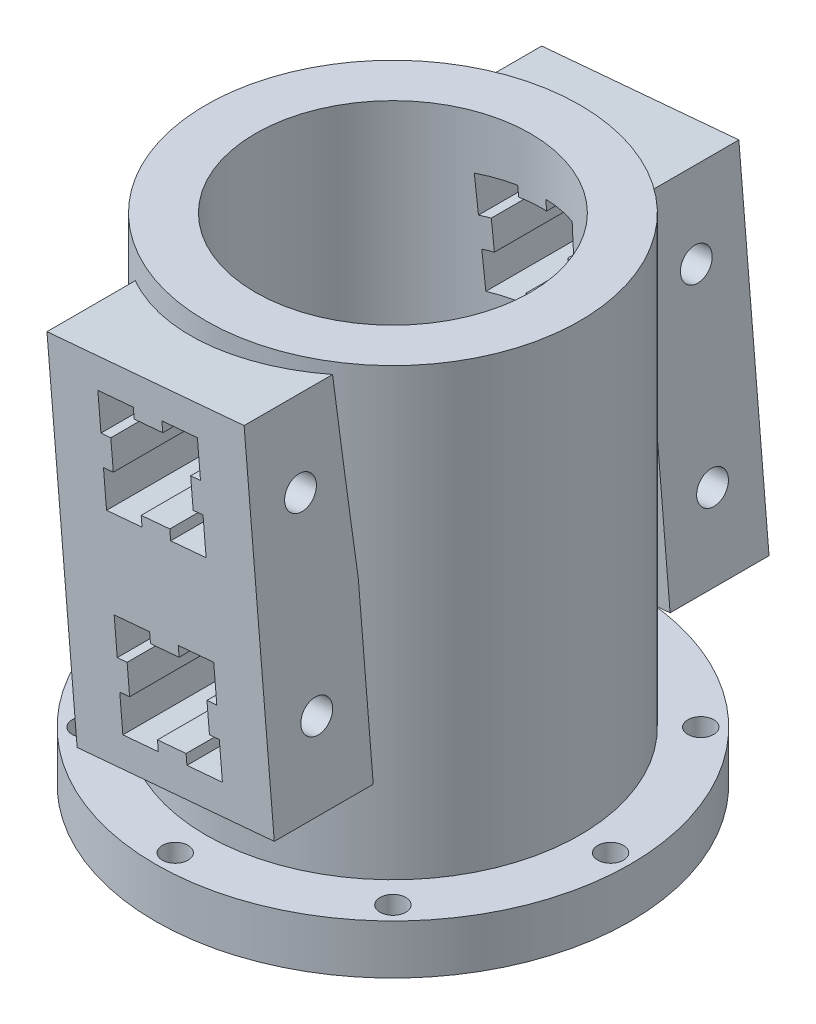
from build123d import *

# Parameters (mm, degrees)
ESQUISSE4_R                = 1.3
FIXINGHOLE_DEPTH           = 61.431779719
FIXINGHOLEREPETITION_COUNT = 8
RIGHTFIXING_DEPTH          = 10
TOPFIXINGHOLES_REACH       = 68.759
ESQUISSE7_R                = 1.6
HOLEFORFIXING_DEPTH        = 75.67261881


with BuildPart() as part:
    # Esquisse1 → Révolution1 (revolve)
    with BuildSketch(Plane.XY):
        Polygon((13.9, 0), (13.9, 50), (18.9, 50), (18.9, 5), (24, 5), (24, 0), align=None)
    revolve(axis=Axis((0, -1.825, 0), (0, 1, 0)))

    # Esquisse4 → FixingHole (cut, through all)
    with BuildSketch(Plane(origin=(0, 0, 0), x_dir=(-1, 0, 0), z_dir=(0, -1, 0))):
        with Locations((0, -22)):
            Circle(ESQUISSE4_R)
    fixinghole = extrude(amount=-FIXINGHOLE_DEPTH, mode=Mode.SUBTRACT)

    # FixingHoleRepetition: FixingHole ×8 about axis
    fixingholerepetition_axis = Axis((0, -1.825, 0), (0, 1, 0))
    for i in range(1, FIXINGHOLEREPETITION_COUNT):
        add(fixinghole.rotate(fixingholerepetition_axis, i * 360 / FIXINGHOLEREPETITION_COUNT), mode=Mode.SUBTRACT)

    # Esquisse5 → RightFixing (add)
    with BuildSketch(Plane.XY.offset(15)):
        Polygon((9.961946981, 48.871557427), (13.012397977, 14.004742994), (-6.911495985, 12.261628139), (-9.961946981, 47.128442573), align=None)
        Polygon((6.889684257, 26.619114826), (7.203444931, 23.032813912), (6.207250232, 22.94565817), (6.460001886, 20.056693545), (7.456196584, 20.143849288), (7.769957258, 16.557548375), (4.183656345, 16.243787701), (4.096500603, 17.239982399), (1.207535978, 16.987230745), (1.294691721, 15.991036047), (-2.291609192, 15.677275373), (-2.605369866, 19.263576286), (-1.609175168, 19.350732029), (-1.861926822, 22.239696653), (-2.85812152, 22.152540911), (-3.171882194, 25.738841824), (0.414418719, 26.052602498), (0.501574462, 25.0564078), (3.390539086, 25.309159454), (3.303383344, 26.305354152), align=None, mode=Mode.SUBTRACT)
        Polygon((5.242440719, 45.447194619), (5.556201393, 41.860893706), (4.560006695, 41.773737964), (4.812758348, 38.884773339), (5.808953047, 38.971929082), (6.12271372, 35.385628169), (2.536412807, 35.071867495), (2.449257065, 36.068062193), (-0.43970756, 35.815310539), (-0.352551817, 34.819115841), (-3.93885273, 34.505355167), (-4.252613404, 38.09165608), (-3.256418706, 38.178811823), (-3.50917036, 41.067776447), (-4.505365058, 40.980620705), (-4.819125732, 44.566921618), (-1.232824819, 44.880682292), (-1.145669076, 43.884487594), (1.743295548, 44.137239247), (1.656139806, 45.133433946), align=None, mode=Mode.SUBTRACT)
    rightfixing = extrude(amount=RIGHTFIXING_DEPTH)

    # Esquisse7 → TopFixingHoles (cut, up to next)
    with BuildSketch(Plane(origin=(14.129503245, 1.236171355, 0), x_dir=(0, 0, -1), z_dir=(0.9961946980917462, 0.08715574274765185, 0)), mode=Mode.PRIVATE) as topfixingholes_sk1:
        with Locations((-20, 39.767345508)):
            Circle(ESQUISSE7_R)
    topfixingholes_tool1 = extrude(topfixingholes_sk1.sketch, amount=-TOPFIXINGHOLES_REACH, mode=Mode.PRIVATE) & part.part
    # Esquisse7 → TopFixingHoles (cut, up to next)
    with BuildSketch(Plane(origin=(14.129503245, 1.236171355, 0), x_dir=(0, 0, -1), z_dir=(0.9961946980917462, 0.08715574274765185, 0)), mode=Mode.PRIVATE) as topfixingholes_sk2:
        with Locations((-20, 20.967345508)):
            Circle(ESQUISSE7_R)
    topfixingholes_tool2 = extrude(topfixingholes_sk2.sketch, amount=-TOPFIXINGHOLES_REACH, mode=Mode.PRIVATE) & part.part
    topfixingholes_1 = topfixingholes_tool1.solids().sort_by_distance((10.663551, 40.85219, 20))[0]
    add(topfixingholes_1, mode=Mode.SUBTRACT)
    topfixingholes_2 = topfixingholes_tool2.solids().sort_by_distance((12.302079, 22.12373, 20))[0]
    add(topfixingholes_2, mode=Mode.SUBTRACT)
    topfixingholes = topfixingholes_1 + topfixingholes_2  # TopFixingHoles as one shape, for the pattern or mirror that repeats it

    # FixingSymetry: RightFixing, TopFixingHoles across plane
    add(rightfixing.mirror(Plane.XY))
    add(topfixingholes.mirror(Plane.XY), mode=Mode.SUBTRACT)

    # Esquisse6 → HoleForFixing (cut, through all)
    with BuildSketch(Plane.XY.offset(25)):
        Polygon((5.242440719, 45.447194619), (5.556201393, 41.860893706), (4.560006695, 41.773737964), (4.812758348, 38.884773339), (5.808953047, 38.971929082), (6.12271372, 35.385628169), (2.536412807, 35.071867495), (2.449257065, 36.068062193), (-0.43970756, 35.815310539), (-0.352551817, 34.819115841), (-3.93885273, 34.505355167), (-4.252613404, 38.09165608), (-3.256418706, 38.178811823), (-3.50917036, 41.067776447), (-4.505365058, 40.980620705), (-4.819125732, 44.566921618), (-1.232824819, 44.880682292), (-1.145669076, 43.884487594), (1.743295548, 44.137239247), (1.656139806, 45.133433946), align=None)
        Polygon((6.889684257, 26.619114826), (7.203444931, 23.032813912), (6.207250232, 22.94565817), (6.460001886, 20.056693545), (7.456196584, 20.143849288), (7.769957258, 16.557548375), (4.183656345, 16.243787701), (4.096500603, 17.239982399), (1.207535978, 16.987230745), (1.294691721, 15.991036047), (-2.291609192, 15.677275373), (-2.605369866, 19.263576286), (-1.609175168, 19.350732029), (-1.861926822, 22.239696653), (-2.85812152, 22.152540911), (-3.171882194, 25.738841824), (0.414418719, 26.052602498), (0.501574462, 25.0564078), (3.390539086, 25.309159454), (3.303383344, 26.305354152), align=None)
    extrude(amount=-HOLEFORFIXING_DEPTH, mode=Mode.SUBTRACT)


solid = part.part
